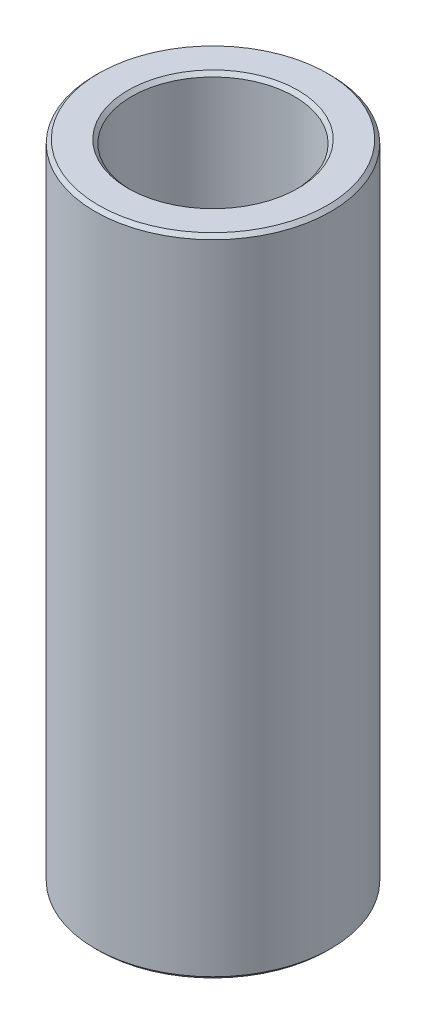
from build123d import *

# Parameters (mm, degrees)
SKETCH1_R           = 55
BOSS_EXTRUDE1_DEPTH = 300.995779483
SKETCH2_R           = 37.974567594
CUT_EXTRUDE1_DEPTH  = 311.883353151
CHAMFER1_SIZE       = 1.670994418


with BuildPart() as part:
    # Sketch1 → Boss-Extrude1 (new body)
    with BuildSketch(Plane(origin=(0, 0, 0), x_dir=(1, 0, 0), z_dir=(0, 1, 0))):
        Circle(SKETCH1_R)
    extrude(amount=BOSS_EXTRUDE1_DEPTH)

    # Sketch2 → Cut-Extrude1 (cut, through all)
    with BuildSketch(Plane(origin=(0, 0, 0), x_dir=(1, 0, 0), z_dir=(0, 1, 0))):
        Circle(SKETCH2_R)
    extrude(amount=CUT_EXTRUDE1_DEPTH, mode=Mode.SUBTRACT)

    # Chamfer1
    chamfer1_edges = [part.edges().sort_by_distance(p)[0] for p in [
        (-37.974567594, 300.995779483, 0),
        (-37.974567594, 0, 0),
        (-55, 0, 0),
        (-55, 300.995779483, 0),
    ]]
    chamfer(chamfer1_edges, length=CHAMFER1_SIZE)


solid = part.part
